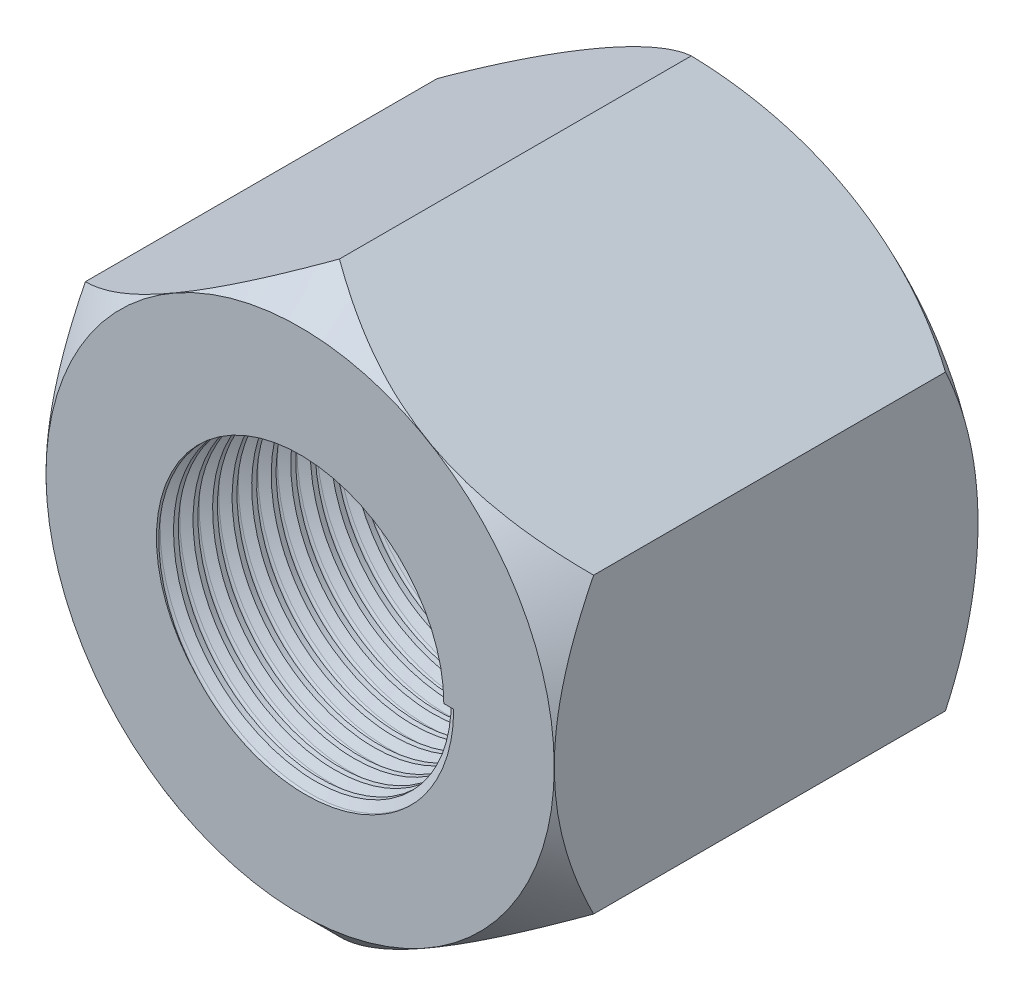
from build123d import *

# Parameters (mm, degrees)
CROQUIS1_R              = 7.505553499
SALIENTE_EXTRUIR1_DEPTH = 12
CHAFL_N1_SIZE           = 1.0062
CORTAR_EXTRUIR1_START   = -12
CORTAR_EXTRUIR1_DEPTH   = 12
CROQUIS8_R              = 3.67525
CORTAR_EXTRUIR2_DEPTH   = 16.575086945
CORTAR_BARRER1_PITCH    = 0.5


with BuildPart() as part:
    # Croquis1 → Saliente-Extruir1 (new body)
    with BuildSketch(Plane.XY):
        Circle(CROQUIS1_R)
    extrude(amount=SALIENTE_EXTRUIR1_DEPTH)

    # Chaflán1
    chafl_n1_edges = [part.edges().sort_by_distance(p)[0] for p in [
        (-7.505553499, 0, 12),
    ]]
    chamfer(chafl_n1_edges, length=CHAFL_N1_SIZE)

    # Cortar-Extruir1: read off the stored shape, not the designer's step
    # Cortar-Extruir1 outline → Cortar-Extruir1 (cut)
    with BuildSketch(Plane.XY.offset(12).offset(CORTAR_EXTRUIR1_START)):
        with BuildLine():
            ThreePointArc((6.499999999, 3.75277675), (3.752776749, 6.5), (0, 7.505553499))
            Line((0, 7.505553499), (6.499999999, 3.75277675))
        make_face()
        with BuildLine():
            Line((-6.499999999, 3.75277675), (0, 7.505553499))
            ThreePointArc((0, 7.505553499), (-3.752776749, 6.5), (-6.499999999, 3.75277675))
        make_face()
        with BuildLine():
            Line((-6.499999999, -3.75277675), (-6.499999999, 3.75277675))
            ThreePointArc((-6.499999999, 3.75277675), (-7.505553499, 0), (-6.499999999, -3.75277675))
        make_face()
        with BuildLine():
            ThreePointArc((6.499999999, -3.75277675), (7.505553499, 0), (6.499999999, 3.75277675))
            Line((6.499999999, 3.75277675), (6.499999999, -3.75277675))
        make_face()
        with BuildLine():
            Line((0, -7.505553499), (-6.499999999, -3.75277675))
            ThreePointArc((-6.499999999, -3.75277675), (-3.752776749, -6.5), (0, -7.505553499))
        make_face()
        with BuildLine():
            ThreePointArc((0, -7.505553499), (3.752776749, -6.5), (6.499999999, -3.75277675))
            Line((6.499999999, -3.75277675), (0, -7.505553499))
        make_face()
    extrude(amount=CORTAR_EXTRUIR1_DEPTH, mode=Mode.SUBTRACT)

    # Croquis3 → Cortar-Revolución2 (revolve, cut)
    with BuildSketch(Plane(origin=(0, 0, 0), x_dir=(0, 0, -1), z_dir=(1, 0, 0)), mode=Mode.PRIVATE) as cortar_revoluci_n2_sk:
        with BuildLine():
            Line((-1.995871229, 7.505553499), (0, 7.505553499))
            Line((0, 7.505553499), (0, 4.5))
            ThreePointArc((0, 4.5), (-0.873871918, 6.085162627), (-1.995871229, 7.505553499))
        make_face()
    revolve(cortar_revoluci_n2_sk.sketch.rotate(Axis((0, 0, 0), (0, 0, 1)), 59.999999927), axis=Axis((0, 0, 0), (0, 0, 1)), mode=Mode.SUBTRACT)

    # Croquis8 → Cortar-Extruir2 (cut, through all)
    with BuildSketch(Plane.XY.offset(12)):
        Circle(CROQUIS8_R)
    extrude(amount=-CORTAR_EXTRUIR2_DEPTH, mode=Mode.SUBTRACT)

    # Cortar-Barrer1: arcs per turn and ends read off the stored shape
    # Cortar-Barrer1: the profile of Croquis9 screwed along a right-hand helix through 24 turns, 6 arcs to a turn; built about Z, then put on its axis
    cortar_barrer1_z = Axis((0, 0, 0), (0, 0, 1))
    cortar_barrer1_corners = [(3.567853324, -6.23e-07, 0.249499998), (3.567853324, -6.23e-07, -0.249500002), (3.891947485, -6.79e-07, -0.062384151), (3.92796499, -6.86e-07, -2e-09), (3.891947485, -6.79e-07, 0.062384146)]
    with BuildLine(mode=Mode.PRIVATE) as cortar_barrer1_profile:
        Line(cortar_barrer1_corners[0], cortar_barrer1_corners[1])
        Line(cortar_barrer1_corners[1], cortar_barrer1_corners[2])
        Line(cortar_barrer1_corners[4], cortar_barrer1_corners[0])
        ThreePointArc((3.891947485, -6.79e-07, -0.062384151), (3.918314129, -6.84e-07, -0.036017507), (3.92796499, -6.86e-07, -2e-09))
        ThreePointArc((3.92796499, -6.86e-07, -2e-09), (3.918314129, -6.84e-07, 0.036017503), (3.891947485, -6.79e-07, 0.062384146))
    cortar_barrer1_cap = Face(cortar_barrer1_profile.wire())
    cortar_barrer1_arcs = [((3.891947485, -6.79e-07, -0.062384151), (3.92796499, -6.86e-07, -0.041589435), (3.92796499, -6.86e-07, -2e-09), (1, 0.8660254037844328, 1)), ((3.92796499, -6.86e-07, -2e-09), (3.92796499, -6.86e-07, 0.04158943), (3.891947485, -6.79e-07, 0.062384146), (1, 0.8660254037844328, 1))]  # start, shoulder, end, weights
    cortar_barrer1_turn_angles = [0, 30, 60, 90, 120, 150, 180, 210, 240, 270, 300, 330, 360]
    cortar_barrer1_turn_weights = [1, 0.8660254037844387, 1, 0.8660254037844387, 1, 0.8660254037844387, 1, 0.8660254037844387, 1, 0.8660254037844387, 1, 0.8660254037844387, 1]
    cortar_barrer1_turn_rails = [Edge.make_bspline([Vector(p[0], p[1], 0).rotate(cortar_barrer1_z, cortar_barrer1_turn_angles[k]) / cortar_barrer1_turn_weights[k] + Vector(0, 0, p[2] + CORTAR_BARRER1_PITCH * cortar_barrer1_turn_angles[k] / 360) for k in range(13)], [0, 0, 0, 1, 1, 2, 2, 3, 3, 4, 4, 5, 5, 6, 6, 6], 2, cortar_barrer1_turn_weights) for p in cortar_barrer1_corners]
    cortar_barrer1_turn_sides = [*[Face.make_surface_from_curves(cortar_barrer1_turn_rails[p[0]], cortar_barrer1_turn_rails[p[1]]) for p in [(0, 1), (1, 2), (4, 0)]], *[Face.make_bezier_surface([[Vector(p[j][0], p[j][1], 0).rotate(cortar_barrer1_z, cortar_barrer1_turn_angles[2 * i + k]) / cortar_barrer1_turn_weights[2 * i + k] + Vector(0, 0, p[j][2] + CORTAR_BARRER1_PITCH * cortar_barrer1_turn_angles[2 * i + k] / 360) for k in range(3)] for j in range(3)], [[p[3][j] * cortar_barrer1_turn_weights[2 * i + k] for k in range(3)] for j in range(3)]) for p in cortar_barrer1_arcs for i in range(6)]]
    cortar_barrer1 = Plane(origin=(0, 0, 12), x_dir=(1, 0, 0), z_dir=(0, 0, -1)) * Solid(Shell([*[p.moved(Location((0, 0, CORTAR_BARRER1_PITCH * i))) for i in range(24) for p in cortar_barrer1_turn_sides], cortar_barrer1_cap, cortar_barrer1_cap.rotate(cortar_barrer1_z, 8640).moved(Location((0, 0, CORTAR_BARRER1_PITCH * 8640 / 360)))]))
    add(cortar_barrer1, mode=Mode.SUBTRACT)


solid = part.part
